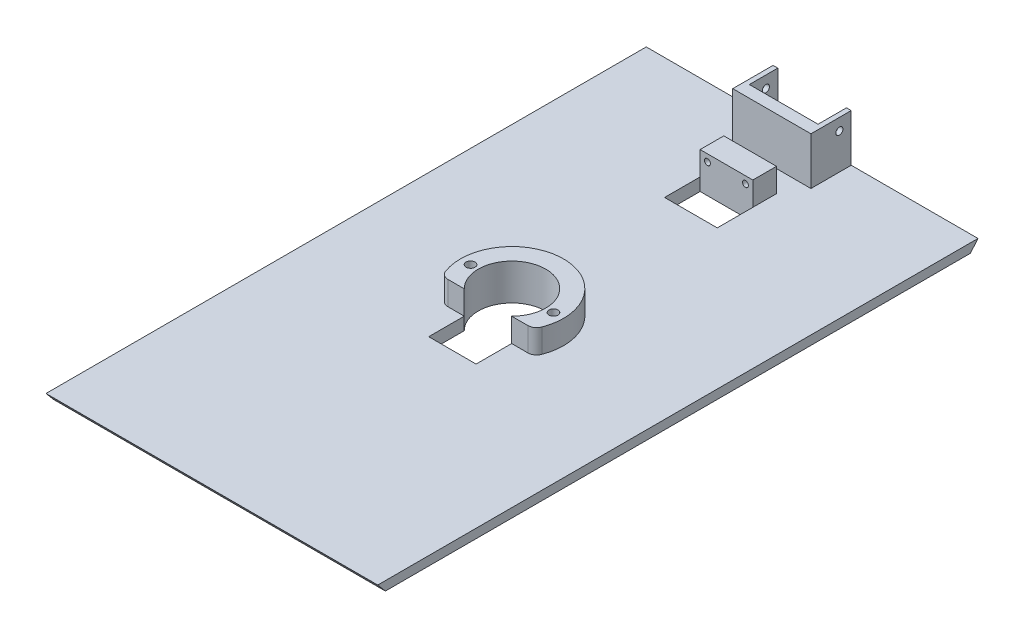
from build123d import *
from OCP.BRepFilletAPI import BRepFilletAPI_MakeChamfer

# Parameters (mm, degrees)
BOSS_EXTRU_1_DEPTH           = 70
BOSS_EXTRU_1_DEPTH_BACK      = 70
ESQUISSE12_W                 = 129.6
ESQUISSE12_H                 = 246.867117592
BOSS_EXTRU_7_DEPTH           = 1.5
CHANFREIN1_SIZE              = 1.5
CHANFREIN1_SIZE_2            = 1.787630389
ENL_V_MAT_EXTRU_1_DEPTH      = 209.036677197
ENL_V_MAT_EXTRU_1_DEPTH_BACK = 209.036677197
BOSS_EXTRU_4_START           = -10
ESQUISSE5_R                  = 1.9
BOSS_EXTRU_4_DEPTH           = 10
ENL_V_MAT_EXTRU_2_DEPTH      = 146.364588204
ENL_V_MAT_EXTRU_2_DEPTH_BACK = 146.364588204
ESQUISSE6_W                  = 22.24
ESQUISSE6_H                  = 15
ESQUISSE7_W                  = 22.24
ESQUISSE7_H                  = 10
BOSS_EXTRU_5_DEPTH           = 10
ESQUISSE8_R                  = 1.25
ENL_V_MAT_EXTRU_3_DEPTH      = 229.570143353
BOSS_EXTRU_6_DEPTH           = 20
ENL_V_MAT_EXTRU_4_DEPTH      = 147.654246266
ENL_V_MAT_EXTRU_4_DEPTH_BACK = 147.654246266
ESQUISSE11_R                 = 1.5


with BuildPart() as part:
    # Esquisse1 → Boss.-Extru.1 (new, two sides: drawn at the far end of the back side and taken through both)
    with BuildSketch(Plane(origin=(0, 0, 0), x_dir=(0, -1, 0), z_dir=(1, 0, 0)).offset(-BOSS_EXTRU_1_DEPTH_BACK)):
        Polygon((0, -123.433558796), (0, 123.433558796), (-3.830222216, 126.647496845), (-3.830222216, -126.647496845), align=None)
    extrude(amount=BOSS_EXTRU_1_DEPTH + BOSS_EXTRU_1_DEPTH_BACK)

    # Esquisse12 → Boss.-Extru.7 (add)
    with BuildSketch(Plane(origin=(0, 0, 0), x_dir=(-1, 0, 0), z_dir=(0, -1, 0))):
        Rectangle(ESQUISSE12_W, ESQUISSE12_H)
    extrude(amount=BOSS_EXTRU_7_DEPTH)

    # Chanfrein1
    chanfrein1_edges_1 = [part.edges().sort_by_distance(p)[0] for p in [
        (0, -1.5, 123.433558796),
    ]]
    chanfrein1_side_1 = [part.faces().sort_by_distance(p)[0] for p in [
        (0, -1.47, 123.433558796),
    ]]
    chanfrein1_edges_2 = [part.edges().sort_by_distance(p)[0] for p in [
        (0, -1.5, -123.433558796),
    ]]
    chanfrein1_side_2 = [part.faces().sort_by_distance(p)[0] for p in [
        (0, -1.47, -123.433558796),
    ]]
    chanfrein1 = BRepFilletAPI_MakeChamfer(part.part.solid().wrapped)
    for e in chanfrein1_edges_1:
        chanfrein1.Add(CHANFREIN1_SIZE - 0.0001, CHANFREIN1_SIZE_2 - 0.0001, e.wrapped, chanfrein1_side_1[0].wrapped)
    for e in chanfrein1_edges_2:
        chanfrein1.Add(CHANFREIN1_SIZE - 0.0001, CHANFREIN1_SIZE_2 - 0.0001, e.wrapped, chanfrein1_side_2[0].wrapped)
    add(Compound.cast(chanfrein1.Shape()), mode=Mode.REPLACE)  # a hair under: the kernel refuses the full size

    # Esquisse4 → Enlèv. mat.-Extru.1 (cut, two sides: drawn at the far end of the back side and taken through both)
    with BuildSketch(Plane(origin=(95, 0, 0), x_dir=(-1, 0, 0), z_dir=(0, -1, 0)).offset(-ENL_V_MAT_EXTRU_1_DEPTH_BACK)):
        with BuildLine():
            Line((105, -25.151970252), (85, -25.151970252))
            Line((85, -25.151970252), (85, -10.151970252))
            ThreePointArc((85, -10.151970252), (95, 14.25), (105, -10.151970252))
            Line((105, -10.151970252), (105, -25.151970252))
        make_face()
    extrude(amount=ENL_V_MAT_EXTRU_1_DEPTH + ENL_V_MAT_EXTRU_1_DEPTH_BACK, mode=Mode.SUBTRACT)

    # Esquisse5 → Boss.-Extru.4 (add)
    with BuildSketch(Plane(origin=(95, 3.830222216, 0), x_dir=(-1, 0, 0), z_dir=(0, -1, 0)).offset(BOSS_EXTRU_4_START)):
        with BuildLine():
            Line((105, -10.151970252), (111.823043033, -10.151970252))
            ThreePointArc((111.823043033, -10.151970252), (113.951535544, -9.489367154), (115.327843665, -7.735714055))
            ThreePointArc((115.327843665, -7.735714055), (95, 21.75), (74.672156335, -7.735714055))
            ThreePointArc((74.672156335, -7.735714055), (76.048464456, -9.489367154), (78.176956967, -10.151970252))
            Line((78.176956967, -10.151970252), (85, -10.151970252))
            ThreePointArc((85, -10.151970252), (95, 14.25), (105, -10.151970252))
        make_face()
        with Locations(Location((77.5, 0, 0), (0, 0, 90))):
            Circle(ESQUISSE5_R, mode=Mode.SUBTRACT)
        with Locations(Location((112.5, 0, 0), (0, 0, 90))):
            Circle(ESQUISSE5_R, mode=Mode.SUBTRACT)
    extrude(amount=BOSS_EXTRU_4_DEPTH)

    # Esquisse6 → Enlèv. mat.-Extru.2 (cut, two sides: drawn at the far end of the back side and taken through both)
    with BuildSketch(Plane(origin=(0, 0, 0), x_dir=(-1, 0, 0), z_dir=(0, -1, 0)).offset(-ENL_V_MAT_EXTRU_2_DEPTH_BACK)):
        with Locations((0, 83)):
            Rectangle(ESQUISSE6_W, ESQUISSE6_H)
    extrude(amount=ENL_V_MAT_EXTRU_2_DEPTH + ENL_V_MAT_EXTRU_2_DEPTH_BACK, mode=Mode.SUBTRACT)

    # Esquisse7 → Boss.-Extru.5 (add)
    with BuildSketch(Plane(origin=(0, 3.830222216, 0), x_dir=(1, 0, 0), z_dir=(0, 1, 0))):
        with Locations((0, 95.5)):
            Rectangle(ESQUISSE7_W, ESQUISSE7_H)
    extrude(amount=BOSS_EXTRU_5_DEPTH)

    # Esquisse8 → Enlèv. mat.-Extru.3 (cut, through all)
    with BuildSketch(Plane.XY.offset(-90.5)):
        with Locations((-8.02, 10.830222216)):
            Circle(ESQUISSE8_R)
        with Locations((8.02, 10.830222216)):
            Circle(ESQUISSE8_R)
    extrude(amount=-ENL_V_MAT_EXTRU_3_DEPTH, mode=Mode.SUBTRACT)

    # Esquisse9 → Boss.-Extru.6 (add)
    with BuildSketch(Plane(origin=(0, 3.830222216, 0), x_dir=(1, 0, 0), z_dir=(0, 1, 0))):
        Polygon((-14.5, 114.647496845), (14.5, 114.647496845), (14.5, 126.647496845), (16.5, 126.647496845), (16.5, 109.647496845), (-16.5, 109.647496845), (-16.5, 126.647496845), (-14.5, 126.647496845), align=None)
    extrude(amount=BOSS_EXTRU_6_DEPTH)

    # Esquisse11 → Enlèv. mat.-Extru.4 (cut, two sides: drawn at the far end of the back side and taken through both)
    with BuildSketch(Plane(origin=(0, 0, 0), x_dir=(0, 0, -1), z_dir=(1, 0, 0)).offset(-ENL_V_MAT_EXTRU_4_DEPTH_BACK)):
        with Locations((121.647496845, 18.830222216)):
            Circle(ESQUISSE11_R)
    extrude(amount=ENL_V_MAT_EXTRU_4_DEPTH + ENL_V_MAT_EXTRU_4_DEPTH_BACK, mode=Mode.SUBTRACT)


solid = part.part
